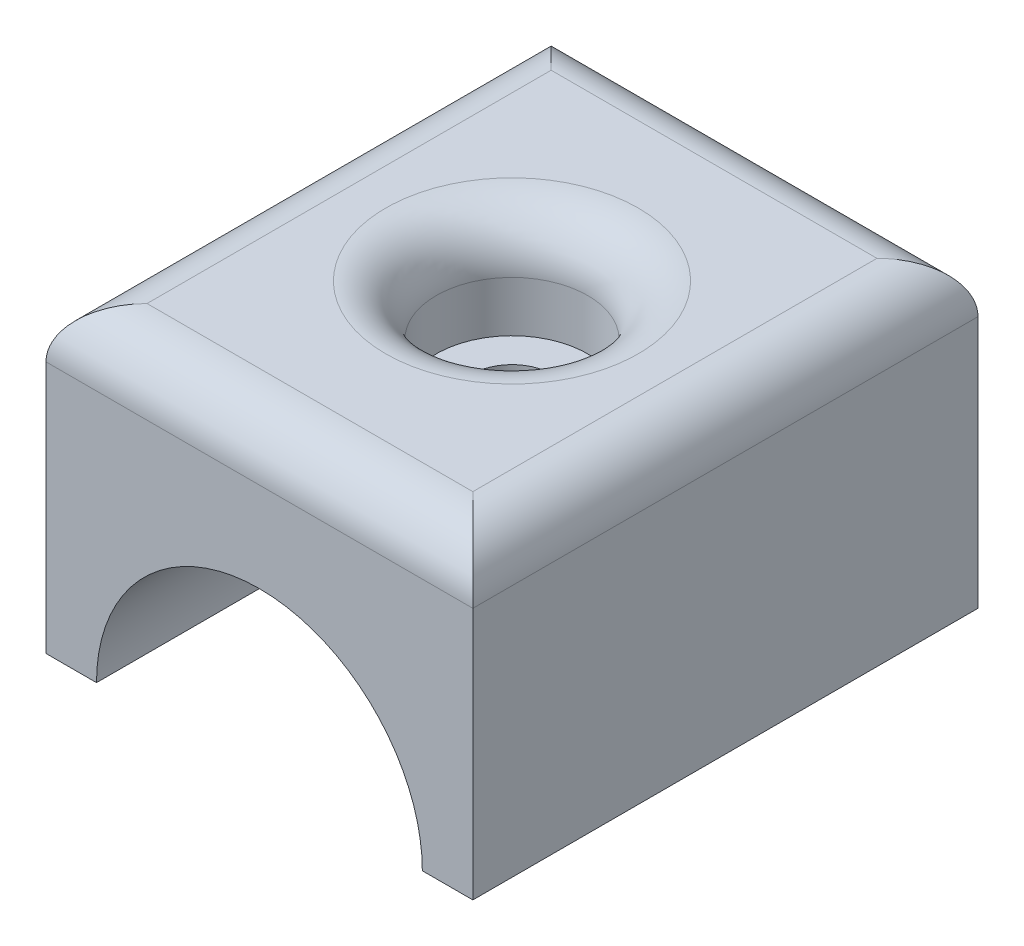
from build123d import *

# Parameters (mm, degrees)
BOSS_EXTRUDE1_DEPTH = 20
SKETCH3_R           = 1.6
CUT_EXTRUDE1_DEPTH  = 20
SKETCH4_R           = 3
CUT_EXTRUDE2_DEPTH  = 4
FILLET5_R           = 2


with BuildPart() as part:
    # Sketch2 → Boss-Extrude1 (new body)
    with BuildSketch(Plane.XY):
        with BuildLine():
            Line((0, 0), (-2, 0))
            Line((-2, 0), (-2, 12))
            Line((-2, 12), (14.9, 12))
            Line((14.9, 12), (14.9, 0))
            Line((14.9, 0), (12.9, 0))
            ThreePointArc((12.9, 0), (6.45, 6.45), (0, 0))
        make_face()
    extrude(amount=-BOSS_EXTRUDE1_DEPTH)

    # Sketch3 → Cut-Extrude1 (cut)
    with BuildSketch(Plane(origin=(0, 12, 0), x_dir=(1, 0, 0), z_dir=(0, 1, 0))):
        with Locations((6.45, 10)):
            Circle(SKETCH3_R)
    extrude(amount=-CUT_EXTRUDE1_DEPTH, mode=Mode.SUBTRACT)

    # Sketch4 → Cut-Extrude2 (cut)
    with BuildSketch(Plane(origin=(0, 12, 0), x_dir=(1, 0, 0), z_dir=(0, 1, 0))):
        with Locations((6.45, 10)):
            Circle(SKETCH4_R)
    extrude(amount=-CUT_EXTRUDE2_DEPTH, mode=Mode.SUBTRACT)

    # Fillet5
    fillet5_edges = [part.edges().sort_by_distance(p)[0] for p in [
        (-2, 12, -10),
        (6.45, 12, -20),
        (14.9, 12, -10),
        (6.45, 12, 0),
        (3.45, 12, -10),
    ]]
    fillet(fillet5_edges, radius=FILLET5_R)


solid = part.part
